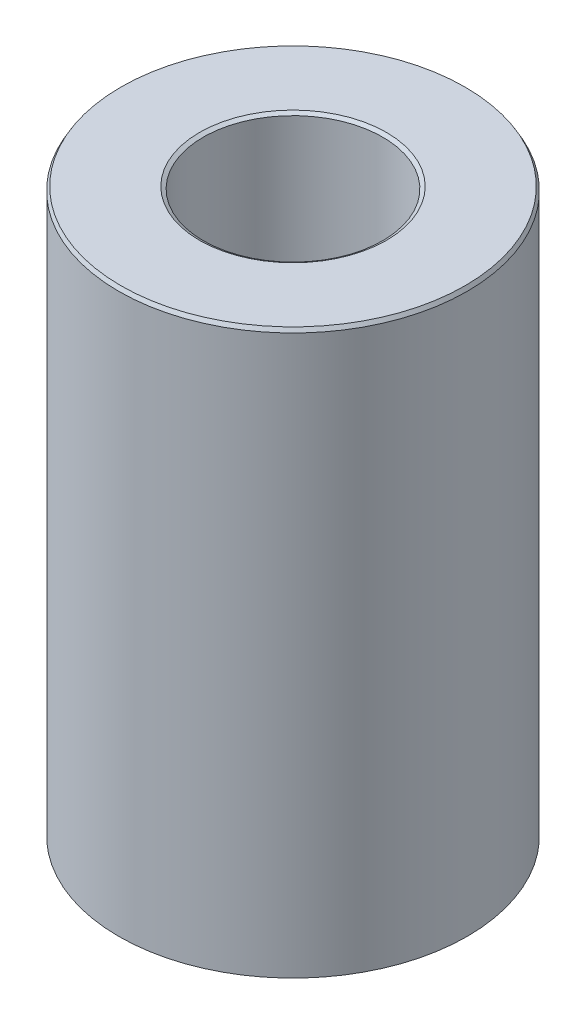
from build123d import *
from OCP.BRepFilletAPI import BRepFilletAPI_MakeChamfer

# Parameters (mm, degrees)
SKETCH1_R           = 57.5
BOSS_EXTRUDE1_DEPTH = 186.307645892
SKETCH2_R           = 29.610508688
CUT_EXTRUDE1_DEPTH  = 204.280689978
CHAMFER1_SIZE       = 1.24081031
CHAMFER1_SIZE2      = 0.716382166


with BuildPart() as part:
    # Sketch1 → Boss-Extrude1 (new body)
    with BuildSketch(Plane(origin=(0, 0, 0), x_dir=(1, 0, 0), z_dir=(0, 1, 0))):
        Circle(SKETCH1_R)
    extrude(amount=BOSS_EXTRUDE1_DEPTH)

    # Sketch2 → Cut-Extrude1 (cut, through all)
    with BuildSketch(Plane(origin=(0, 0, 0), x_dir=(1, 0, 0), z_dir=(0, 1, 0))):
        Circle(SKETCH2_R)
    extrude(amount=CUT_EXTRUDE1_DEPTH, mode=Mode.SUBTRACT)

    # Chamfer1: one chamfer whose edges measure the first distance from different faces: ONE call of the kernel's chamfer builder (chamfer() names one face for all edges)
    chamfer1_edges_1 = [part.edges().sort_by_distance(p)[0] for p in [
        (-29.610508688, 186.307645892, 0),
    ]]
    chamfer1_side_1 = [part.faces().sort_by_distance(p)[0] for p in [
        (-55.873654403, 186.307645892, 0),
    ]]
    chamfer1_edges_2 = [part.edges().sort_by_distance(p)[0] for p in [
        (-29.610508688, 0, 0),
    ]]
    chamfer1_side_2 = [part.faces().sort_by_distance(p)[0] for p in [
        (-29.610508688, 93.153822946, 0),
    ]]
    chamfer1_edges_3 = [part.edges().sort_by_distance(p)[0] for p in [
        (-57.5, 0, 0),
    ]]
    chamfer1_side_3 = [part.faces().sort_by_distance(p)[0] for p in [
        (-55.873654403, 0, 0),
    ]]
    chamfer1_edges_4 = [part.edges().sort_by_distance(p)[0] for p in [
        (-57.5, 186.307645892, 0),
    ]]
    chamfer1_side_4 = [part.faces().sort_by_distance(p)[0] for p in [
        (-57.5, 93.153822946, 0),
    ]]
    chamfer1 = BRepFilletAPI_MakeChamfer(part.part.solid().wrapped)
    for e in chamfer1_edges_1:
        chamfer1.Add(CHAMFER1_SIZE, CHAMFER1_SIZE2, e.wrapped, chamfer1_side_1[0].wrapped)  # the first distance lies on this face
    for e in chamfer1_edges_2:
        chamfer1.Add(CHAMFER1_SIZE, CHAMFER1_SIZE2, e.wrapped, chamfer1_side_2[0].wrapped)  # the first distance lies on this face
    for e in chamfer1_edges_3:
        chamfer1.Add(CHAMFER1_SIZE, CHAMFER1_SIZE2, e.wrapped, chamfer1_side_3[0].wrapped)  # the first distance lies on this face
    for e in chamfer1_edges_4:
        chamfer1.Add(CHAMFER1_SIZE, CHAMFER1_SIZE2, e.wrapped, chamfer1_side_4[0].wrapped)  # the first distance lies on this face
    add(Compound.cast(chamfer1.Shape()), mode=Mode.REPLACE)


solid = part.part
